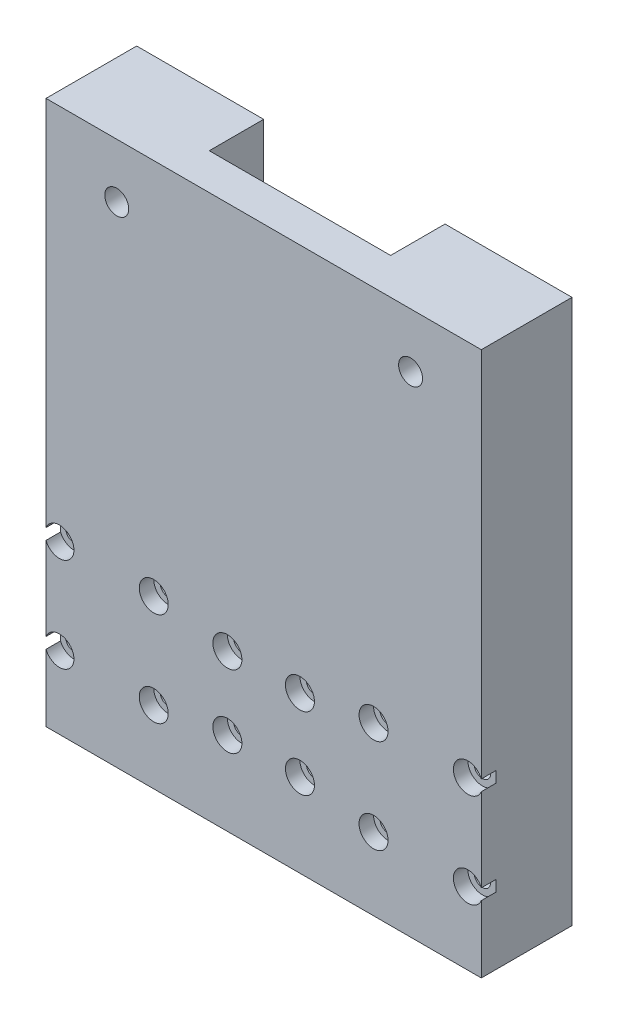
from build123d import *

# Parameters (mm, degrees)
SKETCH1_W                      = 120
SKETCH1_H                      = 150
BOSS_EXTRUDE1_DEPTH            = 25
CBORE_FOR_M4_SHCS1_D           = 4.5
CBORE_FOR_M4_SHCS1_CBORE_D     = 8
CBORE_FOR_M4_SHCS1_CBORE_DEPTH = 4
SKETCH4_W                      = 50
SKETCH4_H                      = 15
CUT_EXTRUDE1_DEPTH             = 194.713706278
M6_CLEARANCE_HOLE1_D           = 6.6


with BuildPart() as part:
    # Sketch1 → Boss-Extrude1 (new body)
    with BuildSketch(Plane.XY):
        with Locations((60, 75)):
            Rectangle(SKETCH1_W, SKETCH1_H)
    extrude(amount=BOSS_EXTRUDE1_DEPTH)

    # CBORE for M4 SHCS1 (through all)
    with Locations(Plane(origin=(3.7, 46, 25), x_dir=(1, 0, 0), z_dir=(0, 0, 1))):
        with Locations((0, 0), (26, 0), (0, -26), (26, -26), (86.6, 0), (112.6, 0), (112.6, -26), (86.6, -26), (46.3, -3), (66.3, -3), (66.3, -23), (46.3, -23)):
            CounterBoreHole(CBORE_FOR_M4_SHCS1_D / 2, CBORE_FOR_M4_SHCS1_CBORE_D / 2, CBORE_FOR_M4_SHCS1_CBORE_DEPTH)

    # Sketch4 → Cut-Extrude1 (cut, through all)
    with BuildSketch(Plane(origin=(0, 150, 0), x_dir=(1, 0, 0), z_dir=(0, 1, 0))):
        with Locations((60, -7.5)):
            Rectangle(SKETCH4_W, SKETCH4_H)
    extrude(amount=-CUT_EXTRUDE1_DEPTH, mode=Mode.SUBTRACT)

    # M6 Clearance Hole1 (through all)
    with Locations(Plane(origin=(19.5, 135, 25), x_dir=(1, 0, 0), z_dir=(0, 0, 1))):
        with Locations((0, 0), (81, 0)):
            Hole(M6_CLEARANCE_HOLE1_D / 2)


solid = part.part
